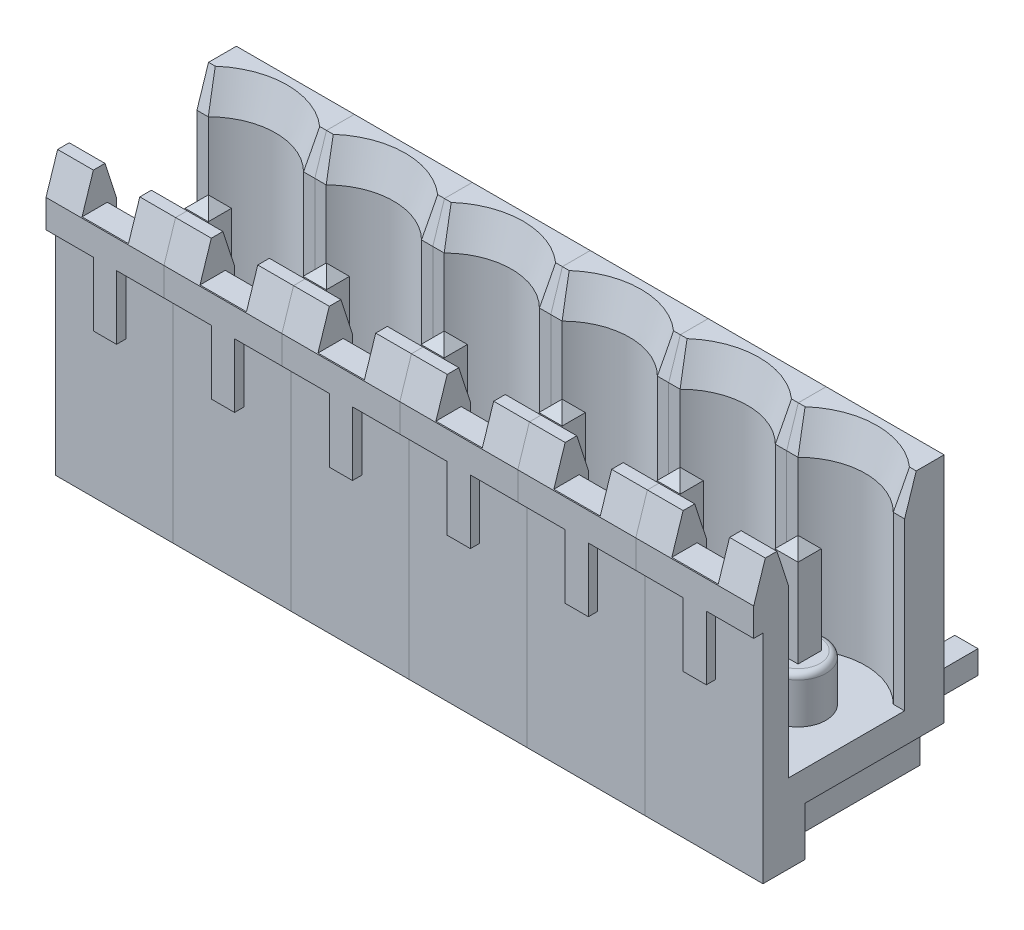
from build123d import *
from OCP.BRepFilletAPI import BRepFilletAPI_MakeChamfer

# Parameters (mm, degrees)
SKETCH_1_W             = 5.08
SKETCH_1_H             = 12.1
EXTRUDE_1_DEPTH        = 8.2
CUT_EXTRUDE_1_DEPTH    = 8.7
SKETCH_3_R             = 1.2
EXTRUDE_2_DEPTH        = 2
FILLET_1_R             = 0.25
CHAMFER_1_SIZE         = 0.5
CHAMFER_1_SIZE2        = 1.538841769
SKETCH_4_W             = 2
SKETCH_4_H             = 1.010953213
CUT_EXTRUDE_2_DEPTH    = 4.75
SKETCH_5_W             = 2
SKETCH_5_H             = 1.705458635
CUT_EXTRUDE_3_DEPTH    = 1.5
CHAMFER_2_SIZE         = 0.5
CHAMFER_2_SIZE2        = 1.538841769
SKETCH_6_W             = 5.08
SKETCH_6_H             = 6.6
CUT_EXTRUDE_4_DEPTH    = 0.4
SKETCH_7_W             = 2.04
SKETCH_7_H             = 2.75
CUT_EXTRUDE_5_DEPTH    = 0.4
EXTRUDE_1_2_DEPTH      = 0.5
EXTRUDE_1_2_DEPTH_BACK = 0.5
CHAMFER_3_SIZE         = 0.5
SKETCH_9_W             = 1
SKETCH_9_H             = 2.1
SKETCH_9_W_2           = 1.04
CUT_EXTRUDE_6_DEPTH    = 6
PATTERN_LINEAR_1_COUNT = 6
PATTERN_LINEAR_1_PITCH = 5.08
MOVE_BODY_1_ANGLE      = 180


with BuildPart() as part:
    # Эскиз1 → Extrude 1 (new body)
    with BuildSketch(Plane(origin=(0, 0, 0), x_dir=(1, 0, 0), z_dir=(0, 1, 0))):
        Rectangle(SKETCH_1_W, SKETCH_1_H)
    extrude(amount=EXTRUDE_1_DEPTH)

    # Эскиз2 → Вырез-Вытянуть1 (cut)
    with BuildSketch(Plane.XY.offset(6.05)):
        with BuildLine():
            Line((-2.54, 6.7), (2.54, 6.7))
            Line((2.54, 6.7), (2.54, 1.7))
            Line((2.54, 1.7), (2.05121915, 1.7))
            ThreePointArc((2.05121915, 1.7), (0, 0.85), (-2.05121915, 1.7))
            Line((-2.05121915, 1.7), (-2.54, 1.7))
            Line((-2.54, 1.7), (-2.54, 6.7))
        make_face()
    extrude(amount=-CUT_EXTRUDE_1_DEPTH, mode=Mode.SUBTRACT)

    # Эскиз3 → Бобышка-Вытянуть2 (add)
    with BuildSketch(Plane.XY.offset(-2.65)):
        with Locations((0, 3.75)):
            Circle(SKETCH_3_R)
    extrude(amount=EXTRUDE_2_DEPTH)

    # Скругление1
    fillet_1_edges = [part.edges().sort_by_distance(p)[0] for p in [
        (-1.2, 3.75, -0.65),
    ]]
    fillet(fillet_1_edges, radius=FILLET_1_R)

    # Фаска1: one chamfer whose edges measure the first distance from different faces: ONE call of the kernel's chamfer builder (chamfer() names one face for all edges)
    chamfer_1_edges_1 = [part.edges().sort_by_distance(p)[0] for p in [
        (0, 6.7, 6.05),
    ]]
    chamfer_1_side_1 = [part.faces().sort_by_distance(p)[0] for p in [
        (0, 7.45, 6.05),
    ]]
    chamfer_1_edges_2 = [part.edges().sort_by_distance(p)[0] for p in [
        (2.295609575, 1.7, 6.05),
        (-2.295609575, 1.7, 6.05),
        (0, 0.85, 6.05),
    ]]
    chamfer_1_side_2 = [part.faces().sort_by_distance(p)[0] for p in [
        (0, 0.655214235, 6.05),
    ]]
    chamfer_1 = BRepFilletAPI_MakeChamfer(part.part.solid().wrapped)
    for e in chamfer_1_edges_1:
        chamfer_1.Add(CHAMFER_1_SIZE, CHAMFER_1_SIZE2, e.wrapped, chamfer_1_side_1[0].wrapped)  # the first distance lies on this face
    for e in chamfer_1_edges_2:
        chamfer_1.Add(CHAMFER_1_SIZE, CHAMFER_1_SIZE2, e.wrapped, chamfer_1_side_2[0].wrapped)  # the first distance lies on this face
    add(Compound.cast(chamfer_1.Shape()), mode=Mode.REPLACE)

    # Эскиз4 → Вырез-Вытянуть2 (cut)
    with BuildSketch(Plane.XY.offset(6.05)):
        with Locations((0, 6.594523394)):
            Rectangle(SKETCH_4_W, SKETCH_4_H)
    extrude(amount=-CUT_EXTRUDE_2_DEPTH, mode=Mode.SUBTRACT)

    # Эскиз5 → Вырез-Вытянуть3 (cut)
    with BuildSketch(Plane.XY.offset(6.05)):
        with Locations((0, 7.552729318)):
            Rectangle(SKETCH_5_W, SKETCH_5_H)
    extrude(amount=-CUT_EXTRUDE_3_DEPTH, mode=Mode.SUBTRACT)

    # Фаска2
    chamfer_2_edges = [part.edges().sort_by_distance(p)[0] for p in [
        (-1.77, 8.2, 6.05),
    ]]
    chamfer_2_side = [part.faces().sort_by_distance(p)[0] for p in [
        (-1.77, 7.7, 6.05),
    ]]
    chamfer(chamfer_2_edges, length=CHAMFER_2_SIZE, length2=CHAMFER_2_SIZE2, reference=chamfer_2_side[0])

    # Эскиз6 → Вырез-Вытянуть4 (cut)
    with BuildSketch(Plane(origin=(0, 8.2, 0), x_dir=(1, 0, 0), z_dir=(0, 1, 0))):
        with Locations((0, 2.75)):
            Rectangle(SKETCH_6_W, SKETCH_6_H)
    extrude(amount=-CUT_EXTRUDE_4_DEPTH, mode=Mode.SUBTRACT)

    # Эскиз7 → Вырез-Вытянуть5 (cut)
    with BuildSketch(Plane(origin=(0, 8.2, 0), x_dir=(1, 0, 0), z_dir=(0, 1, 0))):
        with Locations((1.52, -1.925)):
            Rectangle(SKETCH_7_W, SKETCH_7_H)
        with Locations((-1.52, -1.925)):
            Rectangle(SKETCH_7_W, SKETCH_7_H)
    extrude(amount=-CUT_EXTRUDE_5_DEPTH, mode=Mode.SUBTRACT)

    # Эскиз9 → Вырез-Вытянуть6 (cut)
    with BuildSketch(Plane.XZ):
        with Locations((0, -5)):
            Rectangle(SKETCH_9_W, SKETCH_9_H)
        with Locations((-2.02, -5)):
            Rectangle(SKETCH_9_W_2, SKETCH_9_H)
        with Locations((2.02, -5)):
            Rectangle(SKETCH_9_W_2, SKETCH_9_H)
    extrude(amount=-CUT_EXTRUDE_6_DEPTH, mode=Mode.SUBTRACT)


with BuildPart() as body_2:
    # Эскиз8 → Extrude 1 2 (new, two sides: drawn at the far end of the back side and taken through both)
    with BuildSketch(Plane(origin=(0, 0, 0), x_dir=(0, 0, -1), z_dir=(1, 0, 0)).offset(-EXTRUDE_1_2_DEPTH_BACK)):
        with BuildLine():
            Line((-3.65, 3.25), (3.95, 3.25))
            Line((3.95, 3.25), (3.95, -4))
            Line((3.95, -4), (4.95, -4))
            Line((4.95, -4), (4.95, 3.25))
            ThreePointArc((4.95, 3.25), (4.657106781, 3.957106781), (3.95, 4.25))
            Line((3.95, 4.25), (-3.65, 4.25))
            Line((-3.65, 4.25), (-3.65, 3.25))
        make_face()
    extrude(amount=EXTRUDE_1_2_DEPTH + EXTRUDE_1_2_DEPTH_BACK)

    # Фаска3
    chamfer_3_edges = [body_2.edges().sort_by_distance(p)[0] for p in [
        (0, 3.25, 3.65),
        (0, 4.25, 3.65),
        (0, -4, -4.95),
        (0, -4, -3.95),
        (0.5, -4, -4.45),
        (0.5, 3.75, 3.65),
        (-0.5, 3.75, 3.65),
        (-0.5, -4, -4.45),
    ]]
    chamfer(chamfer_3_edges, length=CHAMFER_3_SIZE - 0.0001)  # a hair under: the kernel refuses the full size


with BuildPart() as pattern_linear_1_1:
    # Линейный массив1: pattern copy
    add(body_2.part.moved(Location(Vector(-1, 0, 0) * (1 * PATTERN_LINEAR_1_PITCH))))


with BuildPart() as pattern_linear_1_2:
    # Линейный массив1: pattern copy
    add(body_2.part.moved(Location(Vector(-1, 0, 0) * (2 * PATTERN_LINEAR_1_PITCH))))


with BuildPart() as pattern_linear_1_3:
    # Линейный массив1: pattern copy
    add(body_2.part.moved(Location(Vector(-1, 0, 0) * (3 * PATTERN_LINEAR_1_PITCH))))


with BuildPart() as pattern_linear_1_4:
    # Линейный массив1: pattern copy
    add(body_2.part.moved(Location(Vector(-1, 0, 0) * (4 * PATTERN_LINEAR_1_PITCH))))


with BuildPart() as pattern_linear_1_5:
    # Линейный массив1: pattern copy
    add(body_2.part.moved(Location(Vector(-1, 0, 0) * (5 * PATTERN_LINEAR_1_PITCH))))


with BuildPart() as pattern_linear_1_6:
    # Линейный массив1: pattern copy
    add(part.part.moved(Location(Vector(-1, 0, 0) * (1 * PATTERN_LINEAR_1_PITCH))))


with BuildPart() as pattern_linear_1_7:
    # Линейный массив1: pattern copy
    add(part.part.moved(Location(Vector(-1, 0, 0) * (2 * PATTERN_LINEAR_1_PITCH))))


with BuildPart() as pattern_linear_1_8:
    # Линейный массив1: pattern copy
    add(part.part.moved(Location(Vector(-1, 0, 0) * (3 * PATTERN_LINEAR_1_PITCH))))


with BuildPart() as pattern_linear_1_9:
    # Линейный массив1: pattern copy
    add(part.part.moved(Location(Vector(-1, 0, 0) * (4 * PATTERN_LINEAR_1_PITCH))))


with BuildPart() as pattern_linear_1_10:
    # Линейный массив1: pattern copy
    add(part.part.moved(Location(Vector(-1, 0, 0) * (5 * PATTERN_LINEAR_1_PITCH))))


with BuildPart() as body_2_1:
    # Move Body 1: moved
    add(body_2.part.rotate(Axis((0, 0, 0), (0, 0.7071067811865488, 0.7071067811865462)), MOVE_BODY_1_ANGLE))


with BuildPart() as part_1:
    # Move Body 1: moved
    add(part.part.rotate(Axis((0, 0, 0), (0, 0.7071067811865488, 0.7071067811865462)), MOVE_BODY_1_ANGLE))


with BuildPart() as pattern_linear_1_1_1:
    # Move Body 1: moved
    add(pattern_linear_1_1.part.rotate(Axis((0, 0, 0), (0, 0.7071067811865488, 0.7071067811865462)), MOVE_BODY_1_ANGLE))


with BuildPart() as pattern_linear_1_6_1:
    # Move Body 1: moved
    add(pattern_linear_1_6.part.rotate(Axis((0, 0, 0), (0, 0.7071067811865488, 0.7071067811865462)), MOVE_BODY_1_ANGLE))


with BuildPart() as pattern_linear_1_7_1:
    # Move Body 1: moved
    add(pattern_linear_1_7.part.rotate(Axis((0, 0, 0), (0, 0.7071067811865488, 0.7071067811865462)), MOVE_BODY_1_ANGLE))


with BuildPart() as pattern_linear_1_8_1:
    # Move Body 1: moved
    add(pattern_linear_1_8.part.rotate(Axis((0, 0, 0), (0, 0.7071067811865488, 0.7071067811865462)), MOVE_BODY_1_ANGLE))


with BuildPart() as pattern_linear_1_2_1:
    # Move Body 1: moved
    add(pattern_linear_1_2.part.rotate(Axis((0, 0, 0), (0, 0.7071067811865488, 0.7071067811865462)), MOVE_BODY_1_ANGLE))


with BuildPart() as pattern_linear_1_3_1:
    # Move Body 1: moved
    add(pattern_linear_1_3.part.rotate(Axis((0, 0, 0), (0, 0.7071067811865488, 0.7071067811865462)), MOVE_BODY_1_ANGLE))


with BuildPart() as pattern_linear_1_9_1:
    # Move Body 1: moved
    add(pattern_linear_1_9.part.rotate(Axis((0, 0, 0), (0, 0.7071067811865488, 0.7071067811865462)), MOVE_BODY_1_ANGLE))


with BuildPart() as pattern_linear_1_10_1:
    # Move Body 1: moved
    add(pattern_linear_1_10.part.rotate(Axis((0, 0, 0), (0, 0.7071067811865488, 0.7071067811865462)), MOVE_BODY_1_ANGLE))


with BuildPart() as pattern_linear_1_4_1:
    # Move Body 1: moved
    add(pattern_linear_1_4.part.rotate(Axis((0, 0, 0), (0, 0.7071067811865488, 0.7071067811865462)), MOVE_BODY_1_ANGLE))


with BuildPart() as pattern_linear_1_5_1:
    # Move Body 1: moved
    add(pattern_linear_1_5.part.rotate(Axis((0, 0, 0), (0, 0.7071067811865488, 0.7071067811865462)), MOVE_BODY_1_ANGLE))


with BuildPart() as pattern_linear_1_5_2:
    # Move Body 2: read off the stored shape, not the designer's step
    # Move Body 2: moved
    add(pattern_linear_1_5_1.part.moved(Location((0, 4.45, 0))))


with BuildPart() as pattern_linear_1_4_2:
    # Move Body 2 2: moved
    add(pattern_linear_1_4_1.part.moved(Location((0, 4.45, 0))))


with BuildPart() as pattern_linear_1_10_2:
    # Move Body 2 3: moved
    add(pattern_linear_1_10_1.part.moved(Location((0, 4.45, 0))))


with BuildPart() as pattern_linear_1_9_2:
    # Move Body 2 4: moved
    add(pattern_linear_1_9_1.part.moved(Location((0, 4.45, 0))))


with BuildPart() as pattern_linear_1_3_2:
    # Move Body 2 5: moved
    add(pattern_linear_1_3_1.part.moved(Location((0, 4.45, 0))))


with BuildPart() as pattern_linear_1_2_2:
    # Move Body 2 6: moved
    add(pattern_linear_1_2_1.part.moved(Location((0, 4.45, 0))))


with BuildPart() as pattern_linear_1_8_2:
    # Move Body 2 7: moved
    add(pattern_linear_1_8_1.part.moved(Location((0, 4.45, 0))))


with BuildPart() as pattern_linear_1_7_2:
    # Move Body 2 8: moved
    add(pattern_linear_1_7_1.part.moved(Location((0, 4.45, 0))))


with BuildPart() as pattern_linear_1_6_2:
    # Move Body 2 9: moved
    add(pattern_linear_1_6_1.part.moved(Location((0, 4.45, 0))))


with BuildPart() as pattern_linear_1_1_2:
    # Move Body 2 10: moved
    add(pattern_linear_1_1_1.part.moved(Location((0, 4.45, 0))))


with BuildPart() as part_2:
    # Move Body 2 11: moved
    add(part_1.part.moved(Location((0, 4.45, 0))))


with BuildPart() as body_2_2:
    # Move Body 2 12: moved
    add(body_2_1.part.moved(Location((0, 4.45, 0))))


solid = Compound([pattern_linear_1_5_2.part, pattern_linear_1_4_2.part, pattern_linear_1_10_2.part, pattern_linear_1_9_2.part, pattern_linear_1_3_2.part, pattern_linear_1_2_2.part, pattern_linear_1_8_2.part, pattern_linear_1_7_2.part, pattern_linear_1_6_2.part, pattern_linear_1_1_2.part, part_2.part, body_2_2.part])
